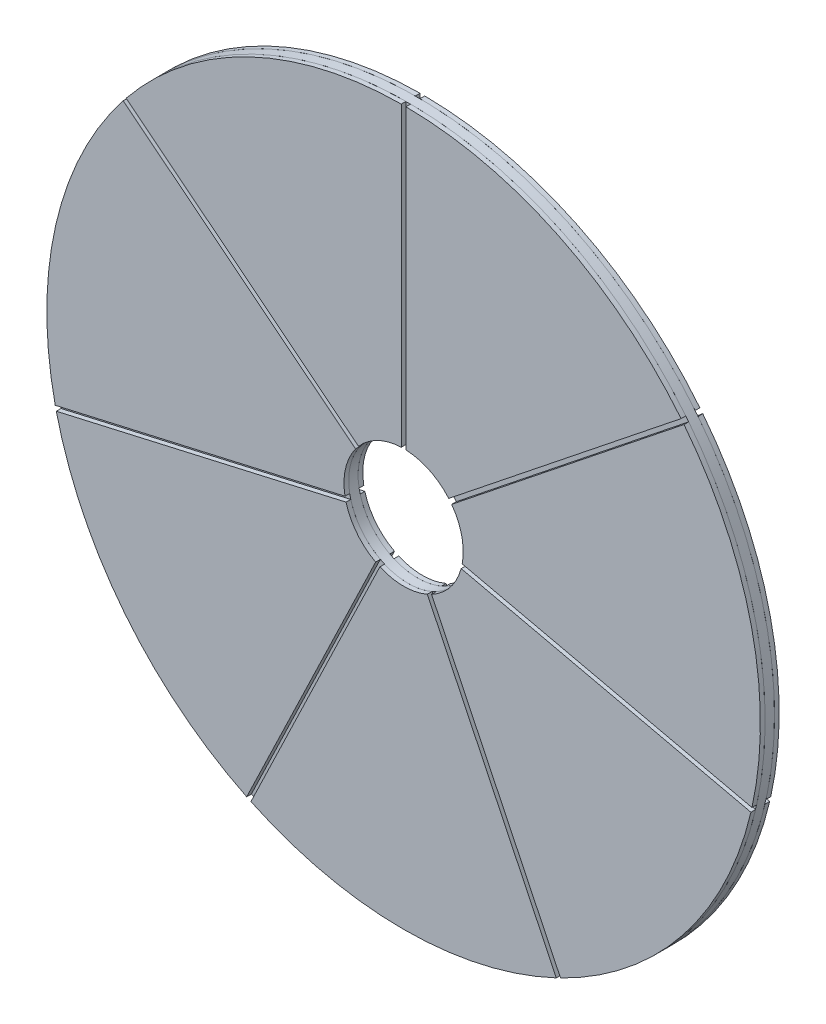
from build123d import *

# Parameters (mm, degrees)
BOSS_EXTRUDE1_DEPTH      = 0.25
BOSS_EXTRUDE1_DEPTH_BACK = 0.25
SKETCH1_R                = 19
BOSS_EXTRUDE2_DEPTH      = 0.25
BOSS_EXTRUDE2_2_DEPTH    = 0.25
BOSS_EXTRUDE2_3_DEPTH    = 0.25
BOSS_EXTRUDE2_4_DEPTH    = 0.25
BOSS_EXTRUDE2_5_DEPTH    = 0.25
BOSS_EXTRUDE2_6_DEPTH    = 0.25
BOSS_EXTRUDE2_7_DEPTH    = 0.25
CUT_EXTRUDE2_DEPTH       = 10
CUT_EXTRUDE2_DEPTH_BACK  = 10
SKETCH3_R                = 3.175


with BuildPart() as part:
    # Sketch1 → Boss-Extrude1 (new, two sides: drawn at the far end of the back side and taken through both)
    with BuildSketch(Plane.XY.offset(-BOSS_EXTRUDE1_DEPTH_BACK)):
        Circle(SKETCH1_R)
    extrude(amount=BOSS_EXTRUDE1_DEPTH + BOSS_EXTRUDE1_DEPTH_BACK)


with BuildPart() as body_2:
    # Sketch2 → Boss-Extrude2 (new body)
    with BuildSketch(Plane.XY.offset(0.25)):
        with BuildLine():
            Line((0.125, 18.999588811), (0.125, 0.259565175))
            Line((0.125, 0.259565175), (14.776540461, 11.943778799))
            ThreePointArc((14.776540461, 11.943778799), (8.243791043, 17.11840849), (0.125, 18.999588811))
        make_face()
    extrude(amount=BOSS_EXTRUDE2_DEPTH)


with BuildPart() as body_3:
    # Sketch2 → Boss-Extrude2 2 (new body)
    with BuildSketch(Plane.XY.offset(0.25)):
        with BuildLine():
            Line((-14.776540461, 11.943778799), (-0.125, 0.259565175))
            Line((-0.125, 0.259565175), (-0.125, 18.999588811))
            ThreePointArc((-0.125, 18.999588811), (-8.243791043, 17.11840849), (-14.776540461, 11.943778799))
        make_face()
    extrude(amount=BOSS_EXTRUDE2_2_DEPTH)


with BuildPart() as body_4:
    # Sketch2 → Boss-Extrude2 3 (new body)
    with BuildSketch(Plane.XY.offset(0.25)):
        with BuildLine():
            Line((-18.551044569, -4.105940258), (-0.28087245, 0.064107304))
            Line((-0.28087245, 0.064107304), (-14.932412912, 11.748320928))
            ThreePointArc((-14.932412912, 11.748320928), (-18.523630331, 4.227897745), (-18.551044569, -4.105940258))
        make_face()
    extrude(amount=BOSS_EXTRUDE2_3_DEPTH)


with BuildPart() as body_5:
    # Sketch2 → Boss-Extrude2 4 (new body)
    with BuildSketch(Plane.XY.offset(0.25)):
        with BuildLine():
            Line((14.932412912, 11.748320928), (0.28087245, 0.064107304))
            Line((0.28087245, 0.064107304), (18.551044569, -4.105940258))
            ThreePointArc((18.551044569, -4.105940258), (18.523630331, 4.227897745), (14.932412912, 11.748320928))
        make_face()
    extrude(amount=BOSS_EXTRUDE2_4_DEPTH)


with BuildPart() as body_6:
    # Sketch2 → Boss-Extrude2 5 (new body)
    with BuildSketch(Plane.XY.offset(0.25)):
        with BuildLine():
            Line((18.495414335, -4.349672236), (0.225242217, -0.179624674))
            Line((0.225242217, -0.179624674), (8.356233744, -17.063802555))
            ThreePointArc((8.356233744, -17.063802555), (14.854798167, -11.846306235), (18.495414335, -4.349672236))
        make_face()
    extrude(amount=BOSS_EXTRUDE2_5_DEPTH)


with BuildPart() as body_7:
    # Sketch2 → Boss-Extrude2 6 (new body)
    with BuildSketch(Plane.XY.offset(0.25)):
        with BuildLine():
            Line((8.130991527, -17.172273489), (0, -0.288095609))
            Line((0, -0.288095609), (-8.130991527, -17.172273489))
            ThreePointArc((-8.130991527, -17.172273489), (0, -19), (8.130991527, -17.172273489))
        make_face()
    extrude(amount=BOSS_EXTRUDE2_6_DEPTH)


with BuildPart() as body_8:
    # Sketch2 → Boss-Extrude2 7 (new body)
    with BuildSketch(Plane.XY.offset(0.25)):
        with BuildLine():
            Line((-8.356233744, -17.063802555), (-0.225242217, -0.179624674))
            Line((-0.225242217, -0.179624674), (-18.495414335, -4.349672236))
            ThreePointArc((-18.495414335, -4.349672236), (-14.854798167, -11.846306235), (-8.356233744, -17.063802555))
        make_face()
    extrude(amount=BOSS_EXTRUDE2_7_DEPTH)


with BuildPart() as body_9:
    # Mirror5: mirrored copy
    add(body_2.part.mirror(Plane.XY))


with BuildPart() as body_10:
    # Mirror5 2: mirrored copy
    add(body_3.part.mirror(Plane.XY))


with BuildPart() as body_11:
    # Mirror5 3: mirrored copy
    add(body_5.part.mirror(Plane.XY))


with BuildPart() as body_12:
    # Mirror5 4: mirrored copy
    add(body_6.part.mirror(Plane.XY))


with BuildPart() as body_13:
    # Mirror5 5: mirrored copy
    add(body_7.part.mirror(Plane.XY))


with BuildPart() as body_14:
    # Mirror5 6: mirrored copy
    add(body_8.part.mirror(Plane.XY))


with BuildPart() as body_15:
    # Mirror5 7: mirrored copy
    add(body_4.part.mirror(Plane.XY))


with BuildPart() as cut_extrude2_tool:
    # Sketch3 → Cut-Extrude2 (new, two sides: drawn at the far end of the back side and taken through both)
    with BuildSketch(Plane.XY.offset(-CUT_EXTRUDE2_DEPTH_BACK)):
        Circle(SKETCH3_R)
    extrude(amount=CUT_EXTRUDE2_DEPTH + CUT_EXTRUDE2_DEPTH_BACK)


with BuildPart() as part_1:
    add(part.part)

    # Cut-Extrude2: cut by cut_extrude2_tool
    add(cut_extrude2_tool.part, mode=Mode.SUBTRACT)


with BuildPart() as body_2_1:
    add(body_2.part)

    # Cut-Extrude2: cut by cut_extrude2_tool
    add(cut_extrude2_tool.part, mode=Mode.SUBTRACT)


with BuildPart() as body_3_1:
    add(body_3.part)

    # Cut-Extrude2: cut by cut_extrude2_tool
    add(cut_extrude2_tool.part, mode=Mode.SUBTRACT)


with BuildPart() as body_4_1:
    add(body_4.part)

    # Cut-Extrude2: cut by cut_extrude2_tool
    add(cut_extrude2_tool.part, mode=Mode.SUBTRACT)


with BuildPart() as body_5_1:
    add(body_5.part)

    # Cut-Extrude2: cut by cut_extrude2_tool
    add(cut_extrude2_tool.part, mode=Mode.SUBTRACT)


with BuildPart() as body_6_1:
    add(body_6.part)

    # Cut-Extrude2: cut by cut_extrude2_tool
    add(cut_extrude2_tool.part, mode=Mode.SUBTRACT)


with BuildPart() as body_7_1:
    add(body_7.part)

    # Cut-Extrude2: cut by cut_extrude2_tool
    add(cut_extrude2_tool.part, mode=Mode.SUBTRACT)


with BuildPart() as body_8_1:
    add(body_8.part)

    # Cut-Extrude2: cut by cut_extrude2_tool
    add(cut_extrude2_tool.part, mode=Mode.SUBTRACT)


with BuildPart() as body_9_1:
    add(body_9.part)

    # Cut-Extrude2: cut by cut_extrude2_tool
    add(cut_extrude2_tool.part, mode=Mode.SUBTRACT)


with BuildPart() as body_10_1:
    add(body_10.part)

    # Cut-Extrude2: cut by cut_extrude2_tool
    add(cut_extrude2_tool.part, mode=Mode.SUBTRACT)


with BuildPart() as body_11_1:
    add(body_11.part)

    # Cut-Extrude2: cut by cut_extrude2_tool
    add(cut_extrude2_tool.part, mode=Mode.SUBTRACT)


with BuildPart() as body_12_1:
    add(body_12.part)

    # Cut-Extrude2: cut by cut_extrude2_tool
    add(cut_extrude2_tool.part, mode=Mode.SUBTRACT)


with BuildPart() as body_13_1:
    add(body_13.part)

    # Cut-Extrude2: cut by cut_extrude2_tool
    add(cut_extrude2_tool.part, mode=Mode.SUBTRACT)


with BuildPart() as body_14_1:
    add(body_14.part)

    # Cut-Extrude2: cut by cut_extrude2_tool
    add(cut_extrude2_tool.part, mode=Mode.SUBTRACT)


with BuildPart() as body_15_1:
    add(body_15.part)

    # Cut-Extrude2: cut by cut_extrude2_tool
    add(cut_extrude2_tool.part, mode=Mode.SUBTRACT)


solid = Compound([part_1.part, body_2_1.part, body_3_1.part, body_4_1.part, body_5_1.part, body_6_1.part, body_7_1.part, body_8_1.part, body_9_1.part, body_10_1.part, body_11_1.part, body_12_1.part, body_13_1.part, body_14_1.part, body_15_1.part])
